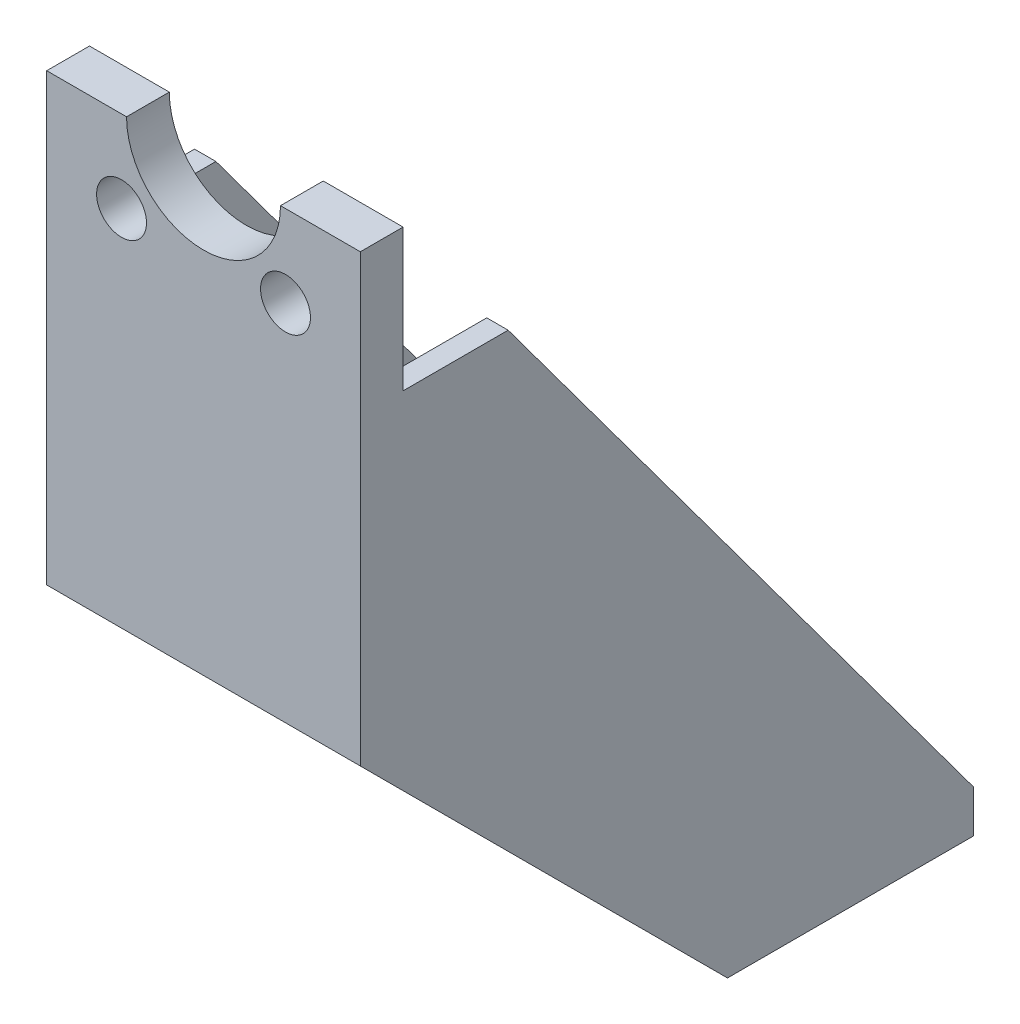
from build123d import *

# Parameters (mm, degrees)
SKETCH1_R               = 1.75
BOSS_EXTRUDE1_DEPTH     = 3
BOSS_EXTRUDE2_DEPTH     = 3
SKETCH4_W               = 40
SKETCH4_H               = 3
BOSS_EXTRUDE3_DEPTH     = 22
SKETCH5_R               = 1.75
CUT_EXTRUDE1_DEPTH      = 10
BOSS_EXTRUDE4_DEPTH     = 1
BOSS_EXTRUDE5_DEPTH     = 22
CUT_EXTRUDE2_DEPTH      = 74.027392121
CUT_EXTRUDE3_DEPTH      = 71.498226928
SKETCH10_R              = 1.75
CUT_EXTRUDE4_DEPTH      = 71.498226928
BOSS_EXTRUDE6_DEPTH     = 1.5
CUT_EXTRUDE5_DEPTH      = 73.589599806
CUT_EXTRUDE5_DEPTH_BACK = 73.589599806


# Read off the part's stored shape, not the designer's step: Boss-Extrude2
with BuildPart() as part:
    # Sketch1 → Boss-Extrude1 (new body)
    with BuildSketch(Plane.XY):
        with BuildLine():
            Line((5.4, 4.03535718), (5.4, 0))
            ThreePointArc((5.4, 0), (0, -5.4), (-5.4, 0))
            Line((-5.4, 0), (-5.4, 4.03535718))
            ThreePointArc((-5.4, 4.03535718), (-7.5, 5.75), (-5.4, 7.46464282))
            Line((-5.4, 7.46464282), (-5.4, 9.583318841))
            ThreePointArc((-5.4, 9.583318841), (0, -11), (5.4, 9.583318841))
            Line((5.4, 9.583318841), (5.4, 7.46464282))
            ThreePointArc((5.4, 7.46464282), (6.856797181, 7.105544171), (7.5, 5.75))
            ThreePointArc((7.5, 5.75), (6.856797181, 4.394455829), (5.4, 4.03535718))
        make_face()
        with Locations((-5.75, -5.75)):
            Circle(SKETCH1_R, mode=Mode.SUBTRACT)
        with Locations((5.75, -5.75)):
            Circle(SKETCH1_R, mode=Mode.SUBTRACT)
    extrude(amount=BOSS_EXTRUDE1_DEPTH)

    # Boss-Extrude2 outline → Boss-Extrude2 (add)
    with BuildSketch(Plane.XY):
        with BuildLine():
            Line((-11, 0), (-11, -57))
            Line((-11, -57), (11, -57))
            Line((11, -57), (11, 0))
            ThreePointArc((11, 0), (0, -11), (-11, 0))
        make_face()
    extrude(amount=BOSS_EXTRUDE2_DEPTH)

    # Sketch4 → Boss-Extrude3 (add)
    with BuildSketch(Plane.ZY.offset(11)):
        with Locations((-20, -55.5)):
            Rectangle(SKETCH4_W, SKETCH4_H)
    extrude(amount=-BOSS_EXTRUDE3_DEPTH)

    # Sketch5 → Cut-Extrude1 (cut)
    with BuildSketch(Plane(origin=(0, -57, 0), x_dir=(-1, 0, 0), z_dir=(0, -1, 0))):
        with Locations(Location((0, 33.63, 0), (0, 0, 90))):
            Circle(SKETCH5_R)
    extrude(amount=-CUT_EXTRUDE1_DEPTH, mode=Mode.SUBTRACT)

    # Sketch6 → Boss-Extrude4 (add)
    with BuildSketch(Plane.ZY.offset(11)):
        Polygon((-20, -54), (0, -34), (0, -54), align=None)
    boss_extrude4 = extrude(amount=-BOSS_EXTRUDE4_DEPTH)

    # Mirror1: Boss-Extrude4 across plane
    add(boss_extrude4.mirror(Plane(origin=(0, 0, 0), x_dir=(0, 0, 1), z_dir=(1, 0, 0))))

    # Sketch7 → Boss-Extrude5 (add, through all)
    with BuildSketch(Plane(origin=(11, 0, 0), x_dir=(0, 0, -1), z_dir=(1, 0, 0))):
        Polygon((0, -30), (24, -54), (19.757359313, -54), (0, -34.242640687), align=None)
    extrude(amount=-BOSS_EXTRUDE5_DEPTH)

    # Sketch8 → Cut-Extrude2 (cut, through all)
    with BuildSketch(Plane(origin=(11, 0, 0), x_dir=(0, 0, -1), z_dir=(1, 0, 0))):
        Polygon((9.878679656, -44.121320344), (22.757359313, -57), (-3, -57), (-3, -31.242640687), align=None)
    extrude(amount=-CUT_EXTRUDE2_DEPTH, mode=Mode.SUBTRACT)

    # Sketch9 → Cut-Extrude3 (cut, through all)
    with BuildSketch(Plane(origin=(0, 0, 0), x_dir=(-1, 0, 0), z_dir=(0, 0, -1))):
        Polygon((-5.4, 0), (-11, 0), (-11, 9.583318841), (11, 9.583318841), (11, 0), align=None)
    extrude(amount=-CUT_EXTRUDE3_DEPTH, mode=Mode.SUBTRACT)

    # Sketch10 → Cut-Extrude4 (cut, through all)
    with BuildSketch(Plane(origin=(0, -57, 0), x_dir=(-1, 0, 0), z_dir=(0, -1, 0))):
        with Locations(Location((5, 33.63, 0), (0, 0, 90))):
            Circle(SKETCH10_R)
        with Locations((-5, 33.63)):
            Circle(SKETCH10_R)
    extrude(amount=-CUT_EXTRUDE4_DEPTH, mode=Mode.SUBTRACT)

    # Sketch11 → Boss-Extrude6 (add)
    with BuildSketch(Plane(origin=(11, 0, 0), x_dir=(0, 0, -1), z_dir=(1, 0, 0))):
        Polygon((0, 0), (40, -54), (40, -57), (22.757359313, -57), (-3, -31.242640687), (-3, 0), align=None)
    boss_extrude6 = extrude(amount=-BOSS_EXTRUDE6_DEPTH)

    # Mirror2: Boss-Extrude6 across plane
    add(boss_extrude6.mirror(Plane(origin=(0, 0, 0), x_dir=(0, 0, 1), z_dir=(1, 0, 0))))

    # Sketch12 → Cut-Extrude5 (cut, two sides: drawn at the far end of the back side and taken through both)
    with BuildSketch(Plane.ZY.offset(-9.5).offset(-CUT_EXTRUDE5_DEPTH_BACK)):
        Polygon((0, 0), (0, -9.949403651), (-10.711431508, -9.949403651), (-10.711431508, 0.731169273), align=None)
    extrude(amount=CUT_EXTRUDE5_DEPTH + CUT_EXTRUDE5_DEPTH_BACK, mode=Mode.SUBTRACT)


solid = part.part
